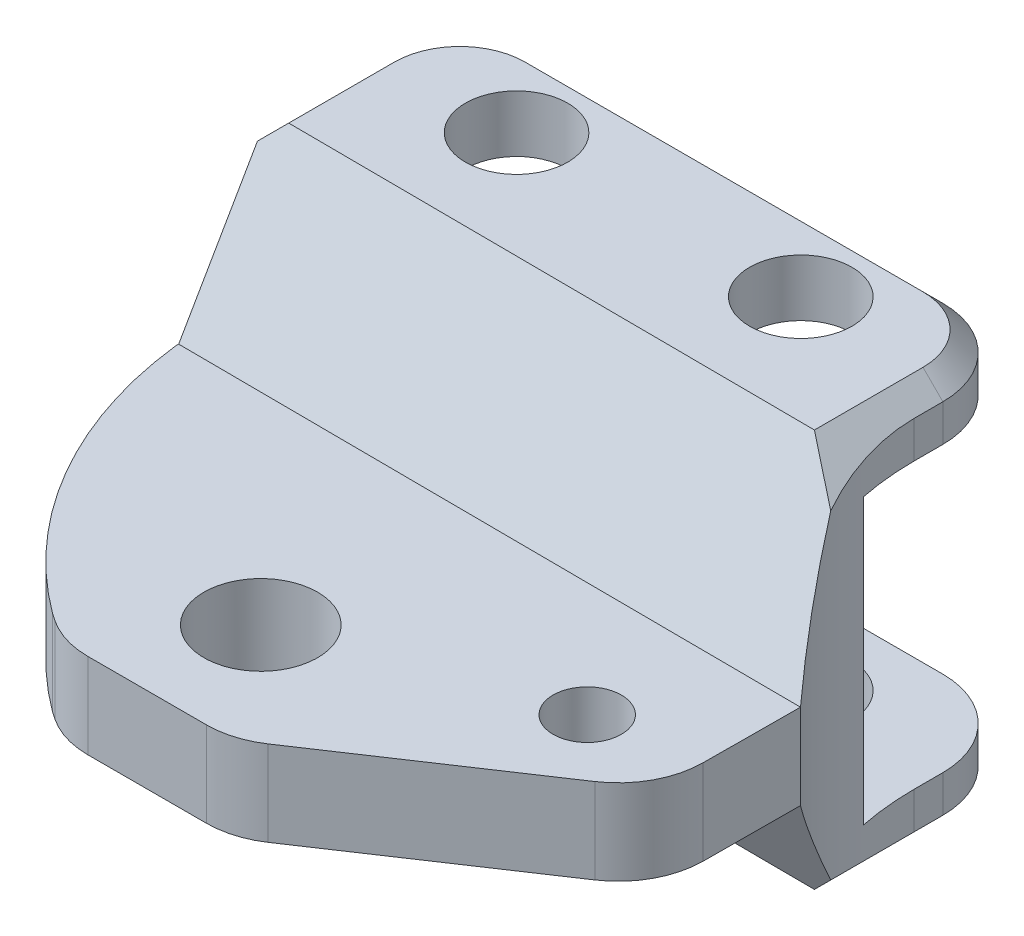
from build123d import *

# Parameters (mm, degrees)
SKETCH1_R           = 1.8
SKETCH1_R_2         = 1.2
SKETCH1_R_3         = 2
BOSS_EXTRUDE1_DEPTH = 7
SKETCH1_3_W         = 20
SKETCH1_3_H         = 6
SKETCH1_3_R         = 1.8
CUT_EXTRUDE1_DEPTH  = 5
FILLET1_R           = 3
CHAMFER3_SIZE       = 0.7
CUT_EXTRUDE2_DEPTH  = 29.072613197
FILLET2_R           = 10
FILLET3_R           = 3


with BuildPart() as part:
    # Sketch1 → Boss-Extrude1 (new, symmetric)
    with BuildSketch(Plane(origin=(0, 0, 0), x_dir=(1, 0, 0), z_dir=(0, 1, 0))):
        with BuildLine():
            Line((10, 5), (-10, 5))
            Line((-10, 5), (-10, -5))
            ThreePointArc((-10, -5), (-8.073014031, -10.781966564), (-4.004817267, -15.320048466))
            Line((-4.004817267, -15.320048466), (-3, -16))
            Line((-3, -16), (3, -16))
            Line((3, -16), (11.972113592, -10.011064555))
            Line((11.972113592, -10.011064555), (11.999968963, -5.011142148))
            Line((11.999968963, -5.011142148), (10, -5))
            Line((10, -5), (10, 5))
        make_face()
        with Locations(Location((-5, 2, 0), (0, 0, 270))):
            Circle(SKETCH1_R, mode=Mode.SUBTRACT)
        with Locations(Location((5, 2, 0), (0, 0, 270))):
            Circle(SKETCH1_R, mode=Mode.SUBTRACT)
        with Locations(Location((8.477738981, -8.991581315, 0), (0, 0, 270))):
            Circle(SKETCH1_R_2, mode=Mode.SUBTRACT)
        with Locations(Location((0, -12, 0), (0, 0, 270))):
            Circle(SKETCH1_R_3, mode=Mode.SUBTRACT)
    extrude(amount=BOSS_EXTRUDE1_DEPTH, both=True)

    # Sketch1<3> → Cut-Extrude1 (cut, symmetric)
    # profile 1 of 2: a face of its own
    with BuildSketch(Plane(origin=(0, 0, 0), x_dir=(1, 0, 0), z_dir=(0, 1, 0))):
        with Locations((0, 2)):
            Rectangle(SKETCH1_3_W, SKETCH1_3_H)
        with Locations(Location((-5, 2, 0), (0, 0, 270))):
            Circle(SKETCH1_3_R, mode=Mode.SUBTRACT)
        with Locations(Location((5, 2, 0), (0, 0, 270))):
            Circle(SKETCH1_3_R, mode=Mode.SUBTRACT)
    # profile 2 of 2: a face of its own
    with BuildSketch(Plane(origin=(0, 0, 0), x_dir=(1, 0, 0), z_dir=(0, 1, 0))):
        with BuildLine():
            Line((-3, -16), (-4.004817267, -15.320048466))
            ThreePointArc((-4.004817267, -15.320048466), (-3.509286078, -15.670187568), (-3, -16))
        make_face()
    extrude(amount=CUT_EXTRUDE1_DEPTH, both=True, mode=Mode.SUBTRACT)

    # Fillet1
    fillet1_edges = [part.edges().sort_by_distance(p)[0] for p in [
        (-10, 6, -5),
        (10, 6, -5),
        (-10, -6, -5),
        (10, -6, -5),
    ]]
    fillet(fillet1_edges, radius=FILLET1_R)

    # Chamfer3
    chamfer3_edges = [part.edges().sort_by_distance(p)[0] for p in [
        (10, -7, 1.5),
        (-10, 7, 1.5),
        (-10, -7, 1.5),
        (10, 7, 1.5),
        (0, -7, -5),
        (9.121320344, -7, -4.121320344),
        (-9.121320344, -7, -4.121320344),
        (0, 7, -5),
        (9.121320344, 7, -4.121320344),
        (-9.121320344, 7, -4.121320344),
    ]]
    chamfer(chamfer3_edges, length=CHAMFER3_SIZE)

    # Sketch2 → Cut-Extrude2 (cut, through all)
    with BuildSketch(Plane(origin=(12.027513532, 0, 0.067007209), x_dir=(0.005571074109334343, 0, -0.9999844814462214), z_dir=(0.9999844814462214, 0, 0.005571074109334343))):
        Polygon((-20.022955032, 1.5), (-20.022955032, 7), (-1.768785186, 7), (-4.944211666, 1.5), align=None)
        Polygon((-20.050357448, -7), (-20.050357448, -1.5), (-4.944211666, -1.5), (-1.768785186, -7), align=None)
    extrude(amount=-CUT_EXTRUDE2_DEPTH, mode=Mode.SUBTRACT)

    # Fillet2
    # the kernel refuses this fillet: 10 mm, written as the material it adds along each edge
    with BuildSketch(Plane(origin=(10, 16.472041172, 5), x_dir=(0, 0, -1), z_dir=(0, -1, 0))) as fillet2_piece_1_section:
        with BuildLine():
            CenterArc((5.988816469, 10), FILLET2_R, 233.130398738, 36.869601262)
            Line((-0.011142148, 1.999968963), (0, 0))
            Line((0, 0), (5.988816469, 0))
        make_face()
    fillet2_piece_1 = extrude(amount=32.944082344, mode=Mode.PRIVATE)
    fillet2_piece_1 = split(fillet2_piece_1, bisect_by=Plane(origin=(10, 5, 5), z_dir=(0, 1, 0)), keep=Keep.TOP, mode=Mode.PRIVATE)
    fillet2_piece_1 = split(fillet2_piece_1, bisect_by=Plane(origin=(10.036117741, 12.729030879, -1.482983393), z_dir=(0.004824691705049313, -0.4999999999999978, -0.8660119643226377)), keep=Keep.TOP, mode=Mode.PRIVATE)
    fillet2_piece_1 = split(fillet2_piece_1, bisect_by=Plane(origin=(4.913979414, 11.386020586, 5), z_dir=(-0.707106781186548, -0.7071067811865471, 0)), keep=Keep.TOP, mode=Mode.PRIVATE)
    add(fillet2_piece_1)
    with BuildSketch(Plane(origin=(10, 16.472041172, 5), x_dir=(0, 0, -1), z_dir=(0, -1, 0))) as fillet2_piece_2_section:
        with BuildLine():
            CenterArc((5.988816469, 10), FILLET2_R, 233.130398738, 36.869601262)
            Line((-0.011142148, 1.999968963), (0, 0))
            Line((0, 0), (5.988816469, 0))
        make_face()
    fillet2_piece_2 = extrude(amount=32.944082344, mode=Mode.PRIVATE)
    fillet2_piece_2 = split(fillet2_piece_2, bisect_by=Plane(origin=(10, 16.472041172, 1), z_dir=(0, 0, 1)), keep=Keep.TOP, mode=Mode.PRIVATE)
    fillet2_piece_2 = split(fillet2_piece_2, bisect_by=Plane(origin=(21.386020586, 5.086020586, 5), z_dir=(-0.707106781186548, 0.7071067811865471, 0)), keep=Keep.TOP, mode=Mode.PRIVATE)
    fillet2_piece_2 = split(fillet2_piece_2, bisect_by=Plane(origin=(9.956645221, 11.979030879, 12.782001339), z_dir=(0.004824691705049311, 0.4999999999999981, -0.8660119643226375)), keep=Keep.TOP, mode=Mode.PRIVATE)
    fillet2_piece_2 = split(fillet2_piece_2, bisect_by=Plane(origin=(10.036117741, 12.729030879, -1.482983393), z_dir=(0.004824691705049313, -0.4999999999999978, -0.8660119643226377)), keep=Keep.TOP, mode=Mode.PRIVATE)
    fillet2_piece_2 = split(fillet2_piece_2, bisect_by=Plane(origin=(4.913979414, 11.386020586, 5), z_dir=(-0.707106781186548, -0.7071067811865471, 0)), keep=Keep.TOP, mode=Mode.PRIVATE)
    add(fillet2_piece_2)
    with BuildSketch(Plane(origin=(10, 16.472041172, 5), x_dir=(0, 0, -1), z_dir=(0, -1, 0))) as fillet2_piece_3_section:
        with BuildLine():
            CenterArc((5.988816469, 10), FILLET2_R, 233.130398738, 36.869601262)
            Line((-0.011142148, 1.999968963), (0, 0))
            Line((0, 0), (5.988816469, 0))
        make_face()
    fillet2_piece_3 = extrude(amount=32.944082344, mode=Mode.PRIVATE)
    fillet2_piece_3 = split(fillet2_piece_3, bisect_by=Plane(origin=(10, -5, 5), z_dir=(0, -1, 0)), keep=Keep.TOP, mode=Mode.PRIVATE)
    fillet2_piece_3 = split(fillet2_piece_3, bisect_by=Plane(origin=(21.386020586, 5.086020586, 5), z_dir=(-0.707106781186548, 0.7071067811865471, 0)), keep=Keep.TOP, mode=Mode.PRIVATE)
    fillet2_piece_3 = split(fillet2_piece_3, bisect_by=Plane(origin=(9.956645221, 11.979030879, 12.782001339), z_dir=(0.004824691705049311, 0.4999999999999981, -0.8660119643226375)), keep=Keep.TOP, mode=Mode.PRIVATE)
    add(fillet2_piece_3)

    # Fillet3
    fillet3_edges = [part.edges().sort_by_distance(p)[0] for p in [
        (11.972113592, 0, 10.011064555),
        (3, 0, 16),
        (-3, 0, 16),
    ]]
    fillet(fillet3_edges, radius=FILLET3_R)


solid = part.part
